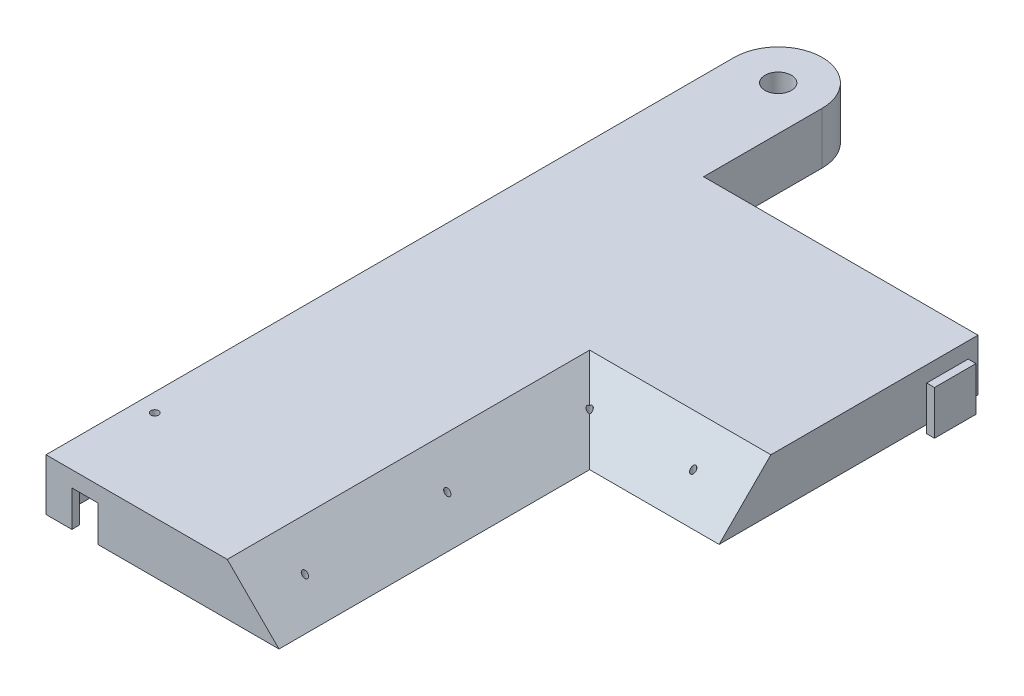
from build123d import *

# Parameters (mm, degrees)
CORNERBOSS_EXTRUDE1_DEPTH               = 20
SHELL2_T                                = -3
PUTBACKSHELLBOSS_EXTRUDE1_DEPTH         = 17
TAB_HOLES_SKETCH1_R                     = 1
TABHOLESCUT_EXTRUDE1_DEPTH              = 317.211923597
PADSKETCH3_R                            = 12
PADSKETCH3_R_2                          = 5
PADBOSS_EXTRUDE2_DEPTH                  = 10
STEPPERSHAFTHOLESKETCH4_R               = 5.1
STEPPERSHAFTHOLESKETCH4_R_2             = 1.5
STEPPERSHAFTCUT_EXTRUDE2_DEPTH          = 316.846451025
THREADEDNUTMOUNTHOLESSKETCH5_R          = 1
THREADEDNUTMOUNTHOLESCUT_EXTRUDE4_DEPTH = 10
TRPEGSKETCH1_W                          = 9.8
TRPEGSKETCH1_H                          = 13.9
TRPEGBOSS_EXTRUDE1_DEPTH                = 3.1
TRPEGCAPSKETCH2_W                       = 16
TRPEGCAPSKETCH2_H                       = 17
TRPEGCAPBOSS_EXTRUDE2_DEPTH             = 3
BOTTOMPEGHOLESKETCH3_W                  = 10
BOTTOMPEGHOLESKETCH3_H                  = 13.9
BOTTOMPEGHOLECUT_EXTRUDE1_DEPTH         = 3


with BuildPart() as part:
    # CornerrSketch1 → CornerBoss-Extrude1 (new body)
    with BuildSketch(Plane(origin=(0, 0, 0), x_dir=(1, 0, 0), z_dir=(0, 1, 0))):
        with BuildLine():
            Line((140, 220), (140, 120))
            Line((140, 120), (90, 120))
            Line((90, 120), (90, 0))
            Line((90, 0), (0, 0))
            Line((0, 0), (0, 265.825))
            ThreePointArc((0, 265.825), (17, 282.825), (34, 265.825))
            Line((34, 265.825), (34, 220))
            Line((34, 220), (140, 220))
        make_face()
    extrude(amount=CORNERBOSS_EXTRUDE1_DEPTH)

    # Shell2
    shell2_openings = [part.faces().sort_by_distance(p)[0] for p in [
        (55.952693014, 0, -131.673048366),
    ]]
    offset(amount=SHELL2_T, openings=shell2_openings, kind=Kind.INTERSECTION)

    # PutBackShellSketch2 → PutBackShellBoss-Extrude1 (add)
    with BuildSketch(Plane.XZ.offset(-17)):
        Polygon((67, -3), (87, -3), (87, -123), (137, -123), (137, -143), (67, -143), align=None)
    extrude(amount=PUTBACKSHELLBOSS_EXTRUDE1_DEPTH)

    # Tab holes-Sketch1 → TabHolesCut-Extrude1 (cut, through all)
    with BuildSketch(Plane(origin=(0, 20, 0), x_dir=(1, 0, 0), z_dir=(0, 1, 0))):
        with Locations(Location((120, 130, 0), (0, 0, 270))):
            Circle(TAB_HOLES_SKETCH1_R)
        with Locations(Location((80, 130, 0), (0, 0, 270))):
            Circle(TAB_HOLES_SKETCH1_R)
        with Locations(Location((80, 75, 0), (0, 0, 270))):
            Circle(TAB_HOLES_SKETCH1_R)
        with Locations(Location((80, 20, 0), (0, 0, 270))):
            Circle(TAB_HOLES_SKETCH1_R)
    extrude(amount=-TABHOLESCUT_EXTRUDE1_DEPTH, mode=Mode.SUBTRACT)

    # PadSketch3 → PadBoss-Extrude2 (add)
    with BuildSketch(Plane.XZ.offset(-17)):
        with Locations(Location((17, -265.825, 0), (0, 0, 90))):
            Circle(PADSKETCH3_R)
        with Locations((7, -35)):
            Circle(PADSKETCH3_R_2)
    extrude(amount=PADBOSS_EXTRUDE2_DEPTH)

    # StepperShaftHoleSketch4 → StepperShaftCut-Extrude2 (cut, through all)
    with BuildSketch(Plane.XZ.offset(-7)):
        with Locations(Location((17, -265.825, 0), (0, 0, 270))):
            Circle(STEPPERSHAFTHOLESKETCH4_R)
        with Locations(Location((7, -35, 0), (0, 0, 270))):
            Circle(STEPPERSHAFTHOLESKETCH4_R_2)
    extrude(amount=-STEPPERSHAFTCUT_EXTRUDE2_DEPTH, mode=Mode.SUBTRACT)

    # ThreadedNutMountHolesSketch5 → ThreadedNutMountHolesCut-Extrude4 (cut)
    with BuildSketch(Plane(origin=(0, 7, 0), x_dir=(-1, 0, 0), z_dir=(0, -1, 0))):
        with Locations(Location((-17, 273.825, 0), (0, 0, 90))):
            Circle(THREADEDNUTMOUNTHOLESSKETCH5_R)
        with Locations(Location((-9, 265.825, 0), (0, 0, 90))):
            Circle(THREADEDNUTMOUNTHOLESSKETCH5_R)
        with Locations(Location((-17, 257.825, 0), (0, 0, 90))):
            Circle(THREADEDNUTMOUNTHOLESSKETCH5_R)
        with Locations(Location((-25, 265.825, 0), (0, 0, 90))):
            Circle(THREADEDNUTMOUNTHOLESSKETCH5_R)
    extrude(amount=-THREADEDNUTMOUNTHOLESCUT_EXTRUDE4_DEPTH, mode=Mode.SUBTRACT)

    # TRPegSketch1 → TRPegBoss-Extrude1 (add)
    with BuildSketch(Plane(origin=(140, 0, 0), x_dir=(0, 0, -1), z_dir=(1, 0, 0))):
        with Locations((205, 6.95)):
            Rectangle(TRPEGSKETCH1_W, TRPEGSKETCH1_H)
    extrude(amount=TRPEGBOSS_EXTRUDE1_DEPTH)

    # TRPegCapSketch2 → TRPegCapBoss-Extrude2 (add)
    with BuildSketch(Plane(origin=(143.1, 0, 0), x_dir=(0, 0, -1), z_dir=(1, 0, 0))):
        with Locations((205.1, 8.5)):
            Rectangle(TRPEGCAPSKETCH2_W, TRPEGCAPSKETCH2_H)
    extrude(amount=TRPEGCAPBOSS_EXTRUDE2_DEPTH)

    # BottomPegHoleSketch3 → BottomPegHoleCut-Extrude1 (cut)
    with BuildSketch(Plane.XY):
        with Locations((15, 6.95)):
            Rectangle(BOTTOMPEGHOLESKETCH3_W, BOTTOMPEGHOLESKETCH3_H)
    extrude(amount=-BOTTOMPEGHOLECUT_EXTRUDE1_DEPTH, mode=Mode.SUBTRACT)

    # OverlapChamfer1
    # the kernel refuses this chamfer: 20 mm, written as the material it takes off along each edge
    with BuildSketch(Plane(origin=(90, 20, -120), x_dir=(0.027495876610586317, -0.9996219169112968, 0), z_dir=(0, 0, 1))) as overlapchamfer1_piece_1:
        with BuildLine():
            Line((20.573463904, 0), (-1.130943098, -20.54235587))
            Line((-1.130943098, -20.54235587), (-1.530791864, -20.53135752))
            ThreePointArc((-1.530791864, -20.53135752), (-0.682584541, -10.267956593), (-0.399848767, 0.010998351))
            Line((-0.399848767, 0.010998351), (0.010998351, 0.399848767))
            ThreePointArc((0.010998351, 0.399848767), (10.289953294, 0.117112992), (20.584462254, 0.399848767))
            Line((20.584462254, 0.399848767), (20.573463904, 0))
        make_face()
    extrude(amount=120, mode=Mode.SUBTRACT)
    with BuildSketch(Plane(origin=(140, 20, -120), x_dir=(0, -0.9996219169112968, 0.027495876610586317), z_dir=(-1, 0, 0))) as overlapchamfer1_piece_2:
        with BuildLine():
            Line((20.573463904, 0), (-1.130943098, -20.54235587))
            Line((-1.130943098, -20.54235587), (-1.530791864, -20.53135752))
            ThreePointArc((-1.530791864, -20.53135752), (-0.682584541, -10.267956593), (-0.399848767, 0.010998351))
            Line((-0.399848767, 0.010998351), (0.010998351, 0.399848767))
            ThreePointArc((0.010998351, 0.399848767), (10.289953294, 0.117112992), (20.584462254, 0.399848767))
            Line((20.584462254, 0.399848767), (20.573463904, 0))
        make_face()
    extrude(amount=50, mode=Mode.SUBTRACT)
    with BuildSketch(Plane(origin=(90, 20, -171.433659759), x_dir=(0.027495876610586317, -0.9996219169112968, 0), z_dir=(0, 0, 1))) as overlapchamfer1_piece_3a_section:
        with BuildLine():
            Line((20.573463904, 0), (-1.130943098, -20.54235587))
            Line((-1.130943098, -20.54235587), (-1.530791864, -20.53135752))
            ThreePointArc((-1.530791864, -20.53135752), (-0.682584541, -10.267956593), (-0.399848767, 0.010998351))
            Line((-0.399848767, 0.010998351), (0.010998351, 0.399848767))
            ThreePointArc((0.010998351, 0.399848767), (10.289953294, 0.117112992), (20.584462254, 0.399848767))
            Line((20.584462254, 0.399848767), (20.573463904, 0))
        make_face()
    overlapchamfer1_piece_3a = extrude(amount=171.433659759, mode=Mode.PRIVATE)
    overlapchamfer1_piece_3a = split(overlapchamfer1_piece_3a, bisect_by=Plane(origin=(83.404127464, 13.404127464, -120), z_dir=(0, 0, -1)), keep=Keep.TOP, mode=Mode.PRIVATE)
    with BuildSketch(Plane(origin=(140, 20, -120), x_dir=(0, -0.9996219169112968, 0.027495876610586317), z_dir=(-1, 0, 0))) as overlapchamfer1_piece_3b_section:
        with BuildLine():
            Line((20.573463904, 0), (-1.130943098, -20.54235587))
            Line((-1.130943098, -20.54235587), (-1.530791864, -20.53135752))
            ThreePointArc((-1.530791864, -20.53135752), (-0.682584541, -10.267956593), (-0.399848767, 0.010998351))
            Line((-0.399848767, 0.010998351), (0.010998351, 0.399848767))
            ThreePointArc((0.010998351, 0.399848767), (10.289953294, 0.117112992), (20.584462254, 0.399848767))
            Line((20.584462254, 0.399848767), (20.573463904, 0))
        make_face()
    overlapchamfer1_piece_3b = extrude(amount=101.433659759, mode=Mode.PRIVATE)
    overlapchamfer1_piece_3b = split(overlapchamfer1_piece_3b, bisect_by=Plane(origin=(90, 13.404127464, -126.595872536), z_dir=(-1, 0, 0)), keep=Keep.TOP, mode=Mode.PRIVATE)
    overlapchamfer1_piece_3 = overlapchamfer1_piece_3a & overlapchamfer1_piece_3b
    add(overlapchamfer1_piece_3, mode=Mode.SUBTRACT)


solid = part.part
